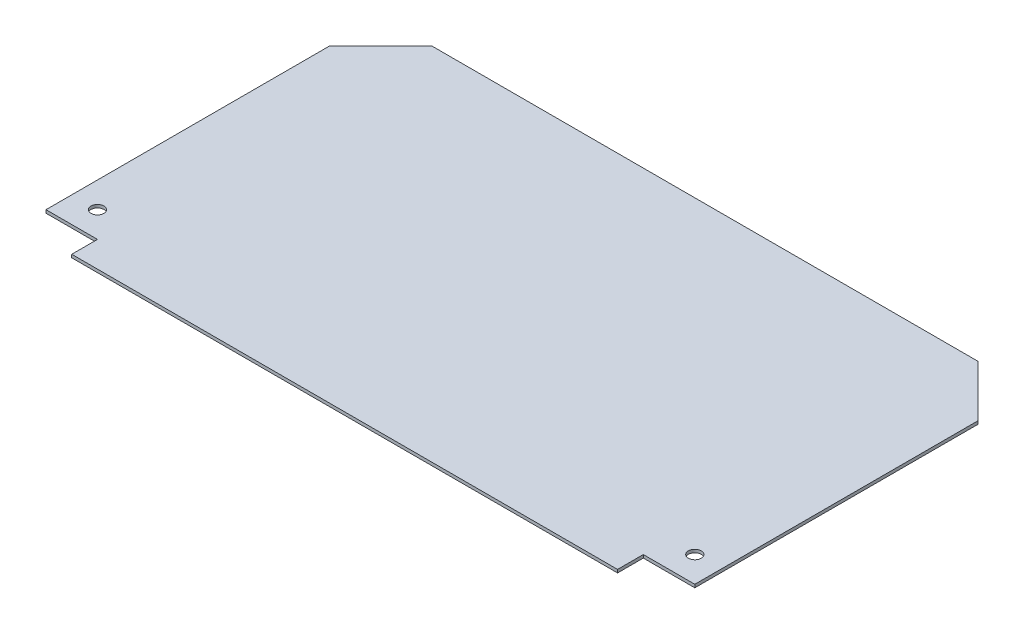
from build123d import *

# Parameters (mm, degrees)
SKETCH_1_R             = 2.5
SM_BASE_FLANGE_1_DEPTH = 1.2


# Sheet-metal steps are written as plain solids
with BuildPart() as part:
    # Sketch 1 → 基材-凸緣1 (new body)
    with BuildSketch(Plane(origin=(0, 0, 0), x_dir=(1, 0, 0), z_dir=(0, 1, 0))):
        Polygon((-126, 0), (-106, 0), (-106, -10), (0, -10), (0, 130), (-106, 130), (-126, 110), align=None)
        with Locations(Location((-116, 10, 0), (0, 0, 270))):
            Circle(SKETCH_1_R, mode=Mode.SUBTRACT)
    extrude(amount=-SM_BASE_FLANGE_1_DEPTH)

    # 鏡射1: part across face


with BuildPart() as part_1:
    add(part.part)
    add(part.part.mirror(Plane(origin=(0, -0.6, -60), x_dir=(0, 0, 1), z_dir=(1, 0, 0))))


solid = part_1.part
